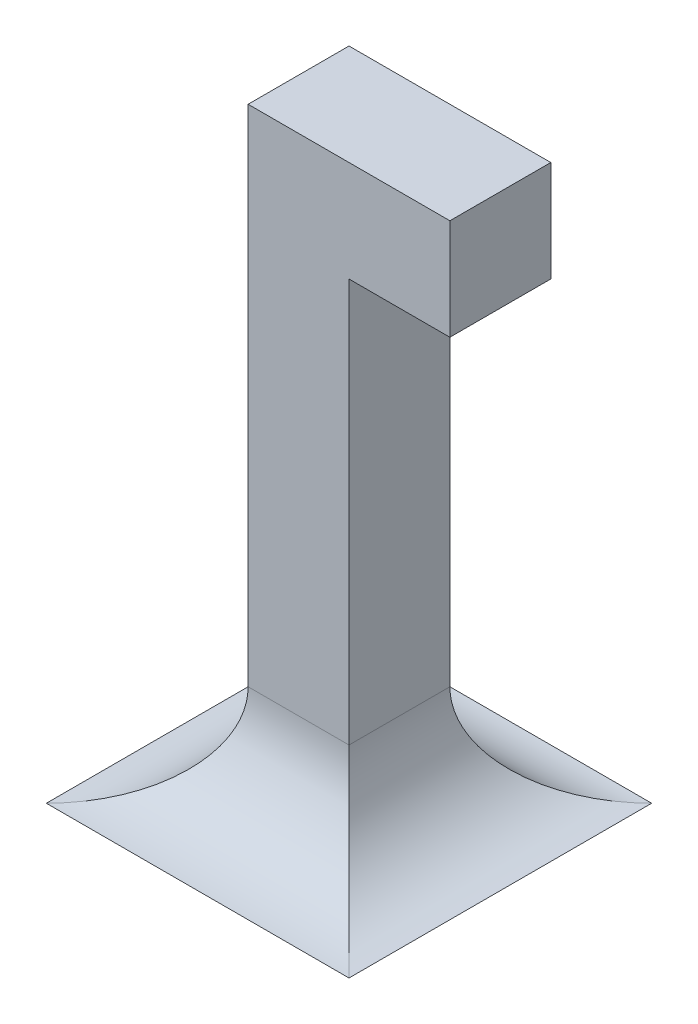
from build123d import *

# Parameters (mm, degrees)
SKETCH1_R           = 5
SKETCH1_R_2         = 10.05
BOSS_EXTRUDE1_DEPTH = 10
SKETCH2_R           = 1.25
CUT_EXTRUDE1_DEPTH  = 10
SKETCH4_R           = 7.5
BOSS_EXTRUDE2_DEPTH = 30
BOSS_EXTRUDE2_TAPER = 7
SKETCH5_R           = 1.25
CUT_EXTRUDE2_DEPTH  = 10
FILLET1_R           = 15
SKETCH6_W           = 5
SKETCH6_H           = 5
BOSS_EXTRUDE3_DEPTH = 30
SKETCH7_W           = 5
SKETCH7_H           = 5
BOSS_EXTRUDE4_DEPTH = 5
FILLET2_R           = 5
SKETCH8_W           = 100
SKETCH8_H           = 10
CUT_EXTRUDE4_DEPTH  = 100


# Some blends are built 0.0001 mm under size
with BuildPart() as part:
    # Sketch1 → Boss-Extrude1 (new body)
    with BuildSketch(Plane(origin=(0, 0, 0), x_dir=(1, 0, 0), z_dir=(0, 1, 0))):
        Polygon((23.995878661, -35), (56.995878661, -35), (56.995878661, -75), (88.995878661, -75), (88.995878661, -25), (88.995878661, 25), (17.5, 25), (-2.004121339, 25), (-2.004121339, 7.840472806), (23.995878661, 7.840472806), (23.995878661, 0), (23.995878661, -28.53803828), (10.495878661, -28.53803828), (10.495878661, -35), align=None)
        with Locations(Location((51.495878661, 0, 0), (0, 0, 270))):
            Circle(SKETCH1_R, mode=Mode.SUBTRACT)
        with Locations(Location((73.995878661, -60, 0), (0, 0, 270))):
            Circle(SKETCH1_R_2, mode=Mode.SUBTRACT)
    extrude(amount=BOSS_EXTRUDE1_DEPTH)

    # Sketch2 → Cut-Extrude1 (cut)
    with BuildSketch(Plane.ZY.offset(-10.495878661)):
        with Locations((31.76901914, 5)):
            Circle(SKETCH2_R)
    extrude(amount=-CUT_EXTRUDE1_DEPTH, mode=Mode.SUBTRACT)

    # Sketch4 → Boss-Extrude2 (add)
    with BuildSketch(Plane(origin=(0, 10, 0), x_dir=(1, 0, 0), z_dir=(0, 1, 0))):
        with Locations((6.495878661, 16.5)):
            Circle(SKETCH4_R)
    extrude(amount=BOSS_EXTRUDE2_DEPTH, taper=BOSS_EXTRUDE2_TAPER)

    # Sketch5 → Cut-Extrude2 (cut)
    with BuildSketch(Plane(origin=(0, 40, 0), x_dir=(1, 0, 0), z_dir=(0, 1, 0))):
        with Locations(Location((6.495878661, 16.5, 0), (0, 0, 270))):
            Circle(SKETCH5_R)
    extrude(amount=-CUT_EXTRUDE2_DEPTH, mode=Mode.SUBTRACT)

    # Fillet1
    # the kernel refuses this fillet: 15 mm, written as the material it adds along each edge
    with BuildSketch(Plane(origin=(56.995878661, 0, 35), x_dir=(-1, 0, 0), z_dir=(0, 1, 0)), Plane(origin=(23.995878661, 0, -7.840472806), x_dir=(-1, 0, 0), z_dir=(0, 1, 0))) as fillet1_piece_1:
        with BuildLine():
            CenterArc((FILLET1_R, FILLET1_R), FILLET1_R, 180, 90)
            Line((0, FILLET1_R), (-FILLET1_R * 0.02, FILLET1_R))
            Line((-FILLET1_R * 0.02, FILLET1_R), (-FILLET1_R * 0.02, -FILLET1_R * 0.02))
            Line((-FILLET1_R * 0.02, -FILLET1_R * 0.02), (FILLET1_R, -FILLET1_R * 0.02))
            Line((FILLET1_R, -FILLET1_R * 0.02), (FILLET1_R, 0))
        make_face()
    extrude(amount=10)
    with BuildSketch(Plane(origin=(23.995878661, 0, 28.53803828), x_dir=(0, 0, -1), z_dir=(0, 1, 0))) as fillet1_piece_2:
        with BuildLine():
            CenterArc((14.924811557, 15), FILLET1_R, 185.739170477, 84.260829523)
            Line((0, 13.5), (-0.298496231, 13.47))
            ThreePointArc((-0.298496231, 13.47), (-0.3, 6.75), (-0.3, 0))
            Line((-0.3, 0), (0, -0.3))
            Line((0, -0.3), (14.924811557, -0.3))
            Line((14.924811557, -0.3), (14.924811557, 0))
        make_face()
    extrude(amount=10)

    # Sketch6 → Boss-Extrude3 (add)
    with BuildSketch(Plane(origin=(0, 10, 0), x_dir=(1, 0, 0), z_dir=(0, 1, 0))):
        with Locations((76.495878661, 17.5)):
            Rectangle(SKETCH6_W, SKETCH6_H)
    extrude(amount=BOSS_EXTRUDE3_DEPTH)

    # Sketch7 → Boss-Extrude4 (add)
    with BuildSketch(Plane(origin=(78.995878661, 0, 0), x_dir=(0, 0, -1), z_dir=(1, 0, 0))):
        with Locations((17.5, 37.5)):
            Rectangle(SKETCH7_W, SKETCH7_H)
    extrude(amount=BOSS_EXTRUDE4_DEPTH)

    # Fillet2
    fillet2_edges = [part.edges().sort_by_distance(p)[0] for p in [
        (78.995878661, 10, -17.5),
        (76.495878661, 10, -20),
        (73.995878661, 10, -17.5),
        (76.495878661, 10, -15),
    ]]
    fillet(fillet2_edges, radius=FILLET2_R - 0.0001)  # a hair under: the kernel refuses the full size

    # Sketch8 → Cut-Extrude4 (cut)
    with BuildSketch(Plane(origin=(88.995878661, 0, 0), x_dir=(0, 0, -1), z_dir=(1, 0, 0))):
        with Locations((-25, 5)):
            Rectangle(SKETCH8_W, SKETCH8_H)
    extrude(amount=-CUT_EXTRUDE4_DEPTH, mode=Mode.SUBTRACT)


with BuildPart() as cut_extrude4_kept_piece:
    # of the separate pieces the step leaves, the one the design keeps (cut_extrude4_pieces_kept)
    add(part.part.solids().sort_by_distance((83.995778661, 10, -24.9999))[0])


solid = cut_extrude4_kept_piece.part
